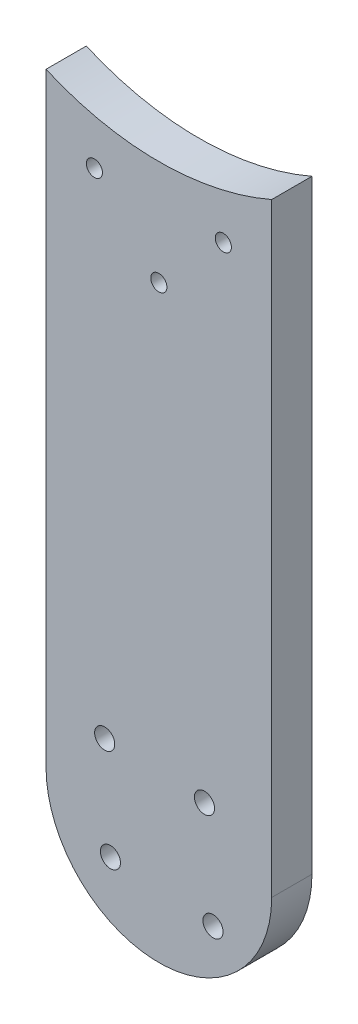
from build123d import *

# Parameters (mm, degrees)
SKETCH1_R           = 1
SKETCH1_R_2         = 1.25
BOSS_EXTRUDE1_DEPTH = 5


with BuildPart() as part:
    # Sketch1 → Boss-Extrude1 (new body)
    with BuildSketch(Plane.XY):
        with BuildLine():
            Line((-14, 0), (-14, 75))
            ThreePointArc((-14, 75), (0, 72.078029865), (14, 75))
            Line((14, 75), (14, 0))
            ThreePointArc((14, 0), (0, -14), (-14, 0))
        make_face()
        with Locations((-8, 67.376014802)):
            Circle(SKETCH1_R, mode=Mode.SUBTRACT)
        with Locations((6.72, -6.72)):
            Circle(SKETCH1_R_2, mode=Mode.SUBTRACT)
        with Locations((-6.01, -5.66)):
            Circle(SKETCH1_R_2, mode=Mode.SUBTRACT)
        with Locations((5.66, 6.01)):
            Circle(SKETCH1_R_2, mode=Mode.SUBTRACT)
        with Locations((-6.72, 6.72)):
            Circle(SKETCH1_R_2, mode=Mode.SUBTRACT)
        with Locations((8, 67.376014802)):
            Circle(SKETCH1_R, mode=Mode.SUBTRACT)
        with Locations((0, 59.072949104)):
            Circle(SKETCH1_R, mode=Mode.SUBTRACT)
    extrude(amount=BOSS_EXTRUDE1_DEPTH)


solid = part.part
